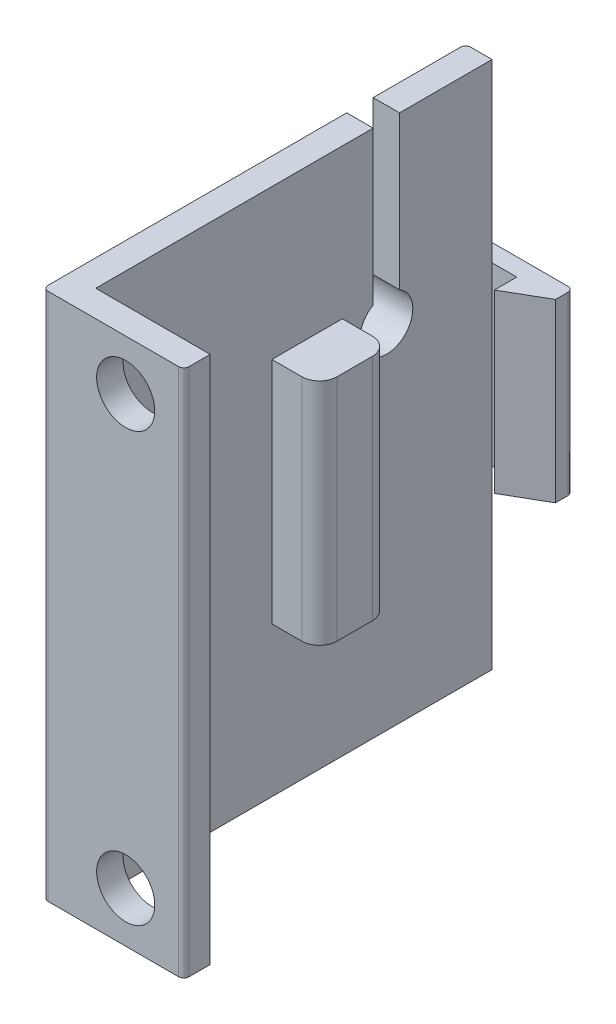
from build123d import *

# Parameters (mm, degrees)
BOSS_EXTRUDE1_DEPTH      = 5
BOSS_EXTRUDE1_DEPTH_BACK = 5
SKETCH2_W                = 3.6
SKETCH2_H                = 10
BOSS_EXTRUDE2_DEPTH      = 1
SKETCH3_W                = 1
SKETCH3_H                = 10
BOSS_EXTRUDE3_DEPTH      = 1.5
SKETCH4_W                = 1.5
SKETCH4_H                = 30
SKETCH4_W_2              = 6.5
SKETCH4_R                = 1.65
BOSS_EXTRUDE4_DEPTH      = 1.5
FILLET1_R                = 0.3
SKETCH5_W                = 4
SKETCH5_H                = 13
BOSS_EXTRUDE5_DEPTH      = 2.7
CUT_EXTRUDE1_DEPTH       = 30.038767191
BOSS_EXTRUDE6_START      = -1.5
BOSS_EXTRUDE6_DEPTH      = 5
CUT_EXTRUDE2_START       = -3
SKETCH8_W                = 2.5
SKETCH8_H                = 6
CUT_EXTRUDE2_DEPTH       = 3
FILLET2_R                = 3
FILLET3_R                = 1
FILLET4_R                = 1


with BuildPart() as part:
    # Sketch1 → Boss-Extrude1 (new, two sides: drawn at the far end of the back side and taken through both)
    with BuildSketch(Plane(origin=(0, 0, 0), x_dir=(1, 0, 0), z_dir=(0, 1, 0)).offset(-BOSS_EXTRUDE1_DEPTH_BACK)):
        Polygon((0, 0), (-2.2, 0), (-2.2, -1.270170592), align=None)
    extrude(amount=BOSS_EXTRUDE1_DEPTH + BOSS_EXTRUDE1_DEPTH_BACK)

    # Sketch2 → Boss-Extrude2 (add)
    with BuildSketch(Plane(origin=(0, 0, 0), x_dir=(-1, 0, 0), z_dir=(0, 0, -1))):
        with Locations((1.8, 0)):
            Rectangle(SKETCH2_W, SKETCH2_H)
    extrude(amount=BOSS_EXTRUDE2_DEPTH)

    # Sketch3 → Boss-Extrude3 (add)
    with BuildSketch(Plane.ZY.offset(3.6)):
        Polygon((0, -5), (0, -15), (22.5, -15), (22.5, 15), (0, 15), (0, 5), align=None)
        with Locations((-0.5, 0)):
            Rectangle(SKETCH3_W, SKETCH3_H)
    extrude(amount=BOSS_EXTRUDE3_DEPTH)

    # Sketch4 → Boss-Extrude4 (add)
    # profile 1 of 2: a face of its own
    with BuildSketch(Plane.XY.offset(22.5)):
        with Locations((-4.35, 0)):
            Rectangle(SKETCH4_W, SKETCH4_H)
    # profile 2 of 2: a face of its own
    with BuildSketch(Plane.XY.offset(22.5)):
        with Locations((-0.35, 0)):
            Rectangle(SKETCH4_W_2, SKETCH4_H)
        with Locations((-0.4, -12.15)):
            Circle(SKETCH4_R, mode=Mode.SUBTRACT)
        with Locations((-0.4, 12.15)):
            Circle(SKETCH4_R, mode=Mode.SUBTRACT)
    extrude(amount=BOSS_EXTRUDE4_DEPTH)

    # Fillet1
    fillet1_edges = [part.edges().sort_by_distance(p)[0] for p in [
        (0, 0, -1),
        (-5.1, 10, 0),
        (-5.1, -10, 0),
        (-5.1, 0, -1),
        (2.9, 0, 24),
        (-5.1, 0, 24),
    ]]
    fillet(fillet1_edges, radius=FILLET1_R)

    # Sketch5 → Boss-Extrude5 (add)
    with BuildSketch(Plane(origin=(-3.6, 0, 0), x_dir=(0, 0, -1), z_dir=(1, 0, 0))):
        with Locations((-10.5, 0)):
            Rectangle(SKETCH5_W, SKETCH5_H)
    extrude(amount=BOSS_EXTRUDE5_DEPTH)

    # Sketch7 → Cut-Extrude1 (cut, through all)
    with BuildSketch(Plane(origin=(-3.6, 0, 0), x_dir=(0, 0, -1), z_dir=(1, 0, 0))):
        with BuildLine():
            Line((-5.25, 6.299038106), (-5.25, 15))
            Line((-5.25, 15), (-6.75, 15))
            Line((-6.75, 15), (-6.75, 6.299038106))
            ThreePointArc((-6.75, 6.299038106), (-6, 3.5), (-5.25, 6.299038106))
        make_face()
    extrude(amount=-CUT_EXTRUDE1_DEPTH, mode=Mode.SUBTRACT)

    # Sketch7<3> → Boss-Extrude6 (add)
    with BuildSketch(Plane(origin=(-3.6, 0, 0), x_dir=(0, 0, -1), z_dir=(1, 0, 0)).offset(BOSS_EXTRUDE6_START)):
        with BuildLine():
            Line((-6.75, 6.299038106), (-6.75, 7.90473751))
            ThreePointArc((-6.75, 7.90473751), (-7.837117307, 2.628291755), (-3, 5))
            ThreePointArc((-3, 5), (-3.628291755, 6.837117307), (-5.25, 7.90473751))
            Line((-5.25, 7.90473751), (-5.25, 6.299038106))
            ThreePointArc((-5.25, 6.299038106), (-4.700961894, 5.75), (-4.5, 5))
            ThreePointArc((-4.5, 5), (-6.75, 3.700961894), (-6.75, 6.299038106))
        make_face()
    extrude(amount=-BOSS_EXTRUDE6_DEPTH)

    # Sketch8 → Cut-Extrude2 (cut)
    with BuildSketch(Plane(origin=(0, 2, 0), x_dir=(-1, 0, 0), z_dir=(0, -1, 0)).offset(CUT_EXTRUDE2_START)):
        with Locations((8.85, -6)):
            Rectangle(SKETCH8_W, SKETCH8_H)
    extrude(amount=CUT_EXTRUDE2_DEPTH, mode=Mode.SUBTRACT)

    # Fillet2
    # the kernel refuses this fillet: 3 mm, written as the material it adds along each edge
    with BuildSketch(Plane(origin=(-7.6, 5, -4.395099729), x_dir=(-1, 0, 0), z_dir=(0, 0, 1))) as fillet2_piece_1_section:
        with BuildLine():
            CenterArc((3, 2.958039892), FILLET2_R, 180, 80.405931773)
            Line((0, 2.958039892), (0, 0))
            Line((0, 0), (2.5, 0))
        make_face()
    fillet2_piece_1 = extrude(amount=16.290199458, mode=Mode.PRIVATE)
    fillet2_piece_1 = fillet2_piece_1 & Plane(origin=(-7.6, 5, 6), x_dir=(0, 0.9682458365518564, 0.2499999999999917), z_dir=(1, 0, 0)) * Cylinder(3, 45, mode=Mode.PRIVATE)
    fillet2_piece_1 = fillet2_piece_1 - Plane(origin=(-7.6, 5, 6), x_dir=(0, 0.8660254037844379, -0.5000000000000012), z_dir=(1, 0, 0)) * Cylinder(1.5, 45, mode=Mode.PRIVATE)
    add(fillet2_piece_1)

    # Fillet3
    fillet3_edges = [part.edges().sort_by_distance(p)[0] for p in [
        (-5.1, 2.628291755, 7.837117307),
    ]]
    fillet(fillet3_edges, radius=FILLET3_R)

    # Fillet4
    fillet4_edges = [part.edges().sort_by_distance(p)[0] for p in [
        (-0.9, 0, 8.5),
        (-0.9, 0, 12.5),
    ]]
    fillet(fillet4_edges, radius=FILLET4_R)


solid = part.part
